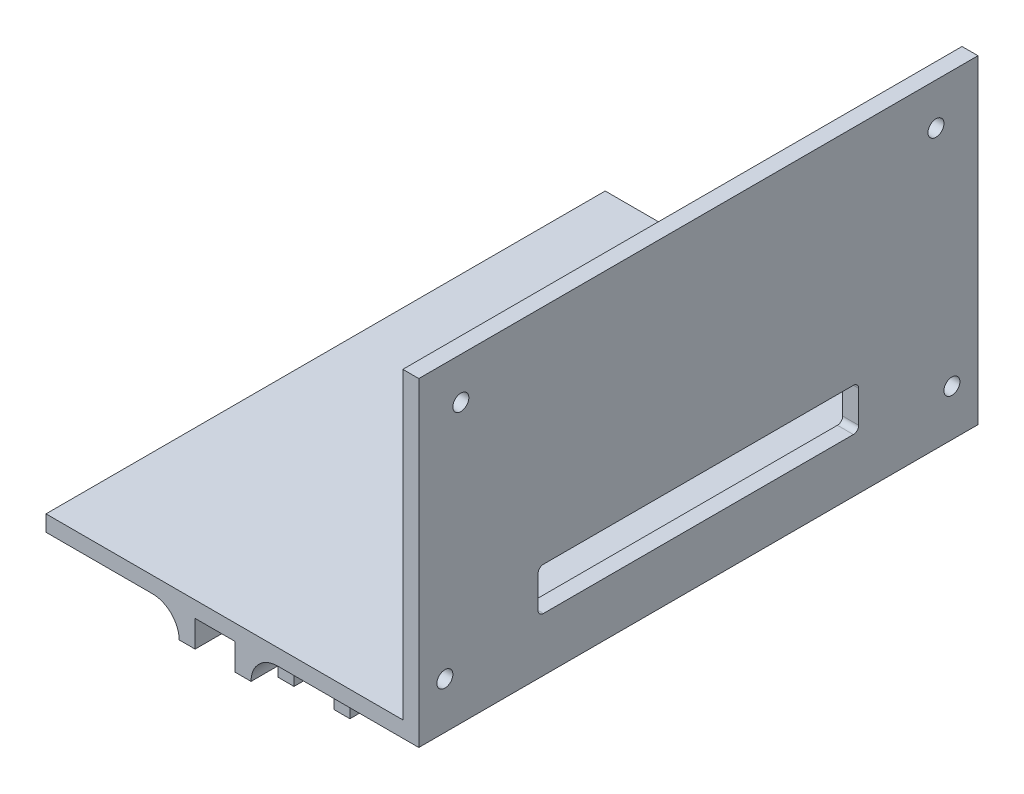
from build123d import *

# Parameters (mm, degrees)
BOSS_EXTRUDE1_DEPTH = 105
SKETCH3_R           = 2.75
CUT_EXTRUDE1_DEPTH  = 146.430395722
SKETCH5_R           = 1.5
CUT_EXTRUDE2_DEPTH  = 154.668474321
SKETCH7_W           = 24.871294837
SKETCH7_H           = 30
CUT_EXTRUDE5_DEPTH  = 19.5
FILLET1_R           = 19.5
CUT_EXTRUDE6_DEPTH  = 154.668474389
CUT_EXTRUDE8_DEPTH  = 146.430395795
FILLET2_R           = 10


with BuildPart() as part:
    # Sketch2 → Boss-Extrude1 (new body)
    with BuildSketch(Plane.XY):
        with BuildLine():
            Line((18.505, 30), (45, 30))
            Line((45, 30), (45, 90))
            Line((45, 90), (42, 90))
            Line((42, 90), (42, 33))
            Line((42, 33), (0, 33))
            Line((0, 33), (-25, 33))
            Line((-25, 33), (-25, 30))
            Line((-25, 30), (-5, 30))
            ThreePointArc((-5, 30), (-1.464466094, 28.535533906), (0, 25))
            Line((0, 25), (0, 0))
            Line((0, 0), (3, 0))
            Line((3, 0), (3, 30))
            Line((3, 30), (10.505, 30))
            Line((10.505, 30), (10.505, 0))
            Line((10.505, 0), (13.505, 0))
            Line((13.505, 0), (13.505, 25))
            ThreePointArc((13.505, 25), (14.969466094, 28.535533906), (18.505, 30))
        make_face()
    extrude(amount=BOSS_EXTRUDE1_DEPTH)

    # Sketch3 → Cut-Extrude1 (cut, through all)
    with BuildSketch(Plane.ZY):
        with Locations((26.25, 20.25)):
            Circle(SKETCH3_R)
        with Locations((78.75, 20.25)):
            Circle(SKETCH3_R)
    extrude(amount=-CUT_EXTRUDE1_DEPTH, mode=Mode.SUBTRACT)

    # Sketch5 → Cut-Extrude2 (cut, through all)
    with BuildSketch(Plane.ZY.offset(-42)):
        with Locations((4.9, 38.71)):
            Circle(SKETCH5_R)
        with Locations(Location((100.1, 38.71, 0), (0, 0, 180))):
            Circle(SKETCH5_R)
        with Locations((7.892916969, 82.187107172)):
            Circle(SKETCH5_R)
        with Locations(Location((97.107083031, 82.187107172, 0), (0, 0, 180))):
            Circle(SKETCH5_R)
    extrude(amount=-CUT_EXTRUDE2_DEPTH, mode=Mode.SUBTRACT)

    # Sketch7 → Cut-Extrude5 (cut)
    with BuildSketch(Plane(origin=(0, 0, 0), x_dir=(-1, 0, 0), z_dir=(0, 0, -1))):
        with Locations((-6.069352582, 15)):
            Rectangle(SKETCH7_W, SKETCH7_H)
    extrude(amount=-CUT_EXTRUDE5_DEPTH, mode=Mode.SUBTRACT)

    # Fillet1
    fillet1_edges = [part.edges().sort_by_distance(p)[0] for p in [
        (-1, 30, 19.5),
        (14.505, 30, 19.5),
    ]]
    fillet(fillet1_edges, radius=FILLET1_R - 0.0001)  # a hair under: the kernel refuses the full size

    # Sketch9 → Cut-Extrude6 (cut, through all)
    with BuildSketch(Plane.ZY.offset(-42)):
        with BuildLine():
            Line((23.4, 48.1), (81.6, 48.1))
            ThreePointArc((81.6, 48.1), (82.307106781, 47.807106781), (82.6, 47.1))
            Line((82.6, 47.1), (82.6, 41.1))
            ThreePointArc((82.6, 41.1), (82.307106781, 40.392893219), (81.6, 40.1))
            Line((81.6, 40.1), (23.4, 40.1))
            ThreePointArc((23.4, 40.1), (22.692893219, 40.392893219), (22.4, 41.1))
            Line((22.4, 41.1), (22.4, 47.1))
            ThreePointArc((22.4, 47.1), (22.692893219, 47.807106781), (23.4, 48.1))
        make_face()
    extrude(amount=-CUT_EXTRUDE6_DEPTH, mode=Mode.SUBTRACT)

    # Sketch10 → Cut-Extrude8 (cut, through all)
    with BuildSketch(Plane.ZY):
        Polygon((19.5, 0), (36.004964036, 0), (70.668478518, 0), (86.438146051, 0), (105, 0), (105, 9.649634618), (105, 25), (86.438146051, 25), (86.438146051, 9.649634618), (70.668478518, 9.649634618), (70.668478518, 25), (36.004964036, 25), (36.004964036, 9.649634618), (19.5, 9.649634618), align=None)
    extrude(amount=-CUT_EXTRUDE8_DEPTH, mode=Mode.SUBTRACT)

    # Fillet2
    fillet2_edges = [part.edges().sort_by_distance(p)[0] for p in [
        (1.5, 25, 36.004964036),
        (12.005, 25, 36.004964036),
        (1.5, 25, 70.668478518),
        (12.005, 25, 70.668478518),
        (1.5, 25, 86.438146051),
        (12.005, 25, 86.438146051),
    ]]
    fillet(fillet2_edges, radius=FILLET2_R)


solid = part.part
